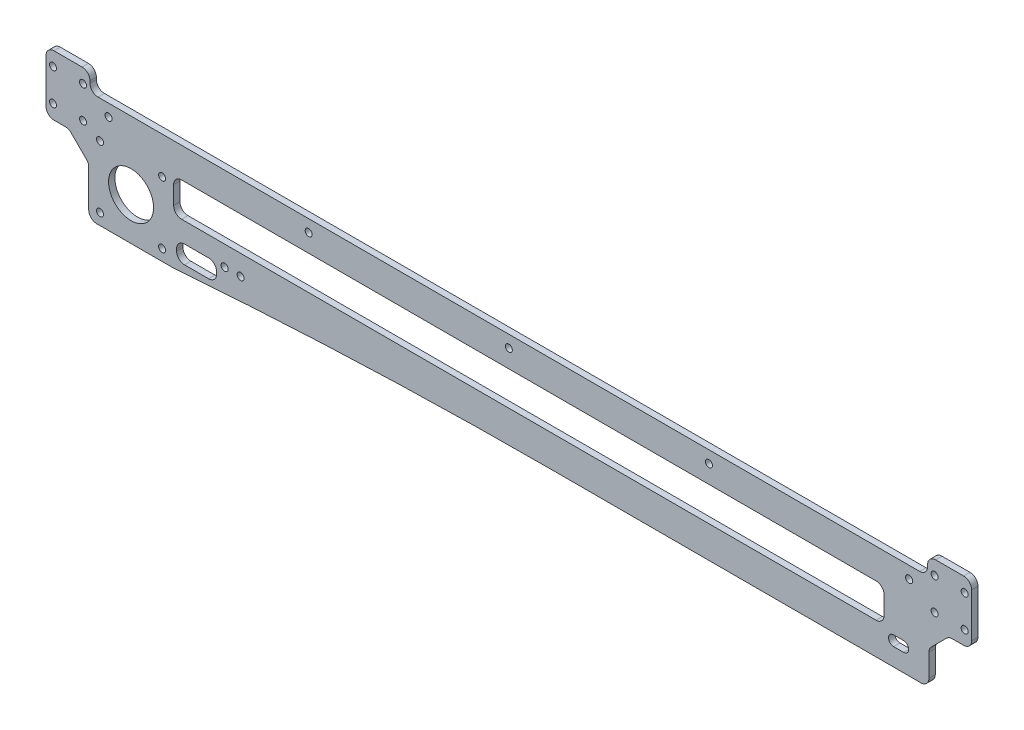
from build123d import *

# Parameters (mm, degrees)
SKETCH5_R          = 1.75
SKETCH5_R_2        = 11.25
SKETCH5_W          = 20
SKETCH5_H          = 9
SKETCH5_W_2        = 355
SKETCH5_H_2        = 17
BASE_FLANGE1_DEPTH = 3.175
FILLET1_R          = 4
CHAMFER1_SIZE      = 10
FILLET2_R          = 4


# Sheet-metal steps are written as plain solids
with BuildPart() as part:
    # Sketch5 → Base-Flange1 (new body)
    with BuildSketch(Plane.XY):
        with BuildLine():
            Line((-209.9, -15), (-209.9, -49.15))
            Line((-209.9, -49.15), (-167.6, -49.15))
            ThreePointArc((-167.6, -49.15), (-73.294416762, -43.720078691), (21.15, -41.909217598))
            Line((21.15, -41.909217598), (209.9, -41.909217598))
            Line((209.9, -41.909217598), (209.9, -15))
            Line((209.9, -15), (231.25, -15))
            Line((231.25, -15), (231.25, 15))
            Line((231.25, 15), (209.25, 15))
            Line((209.25, 15), (209.25, 6))
            Line((209.25, 6), (-209.25, 6))
            Line((-209.25, 6), (-209.25, 15))
            Line((-209.25, 15), (-231.25, 15))
            Line((-231.25, 15), (-231.25, -15))
            Line((-231.25, -15), (-209.9, -15))
        make_face()
        with Locations((-134, -36)):
            Circle(SKETCH5_R, mode=Mode.SUBTRACT)
        with Locations((-142, -36)):
            Circle(SKETCH5_R, mode=Mode.SUBTRACT)
        with Locations((-173.25, -43.5)):
            Circle(SKETCH5_R, mode=Mode.SUBTRACT)
        with Locations((-204.25, -43.5)):
            Circle(SKETCH5_R, mode=Mode.SUBTRACT)
        with Locations((-188.75, -28)):
            Circle(SKETCH5_R_2, mode=Mode.SUBTRACT)
        with Locations((-173.25, -12.5)):
            Circle(SKETCH5_R, mode=Mode.SUBTRACT)
        with Locations((-204.25, -12.5)):
            Circle(SKETCH5_R, mode=Mode.SUBTRACT)
        with Locations((212.75, -8)):
            Circle(SKETCH5_R, mode=Mode.SUBTRACT)
        with Locations((227.75, -8)):
            Circle(SKETCH5_R, mode=Mode.SUBTRACT)
        with Locations((227.75, 8)):
            Circle(SKETCH5_R, mode=Mode.SUBTRACT)
        with Locations((212.75, 8)):
            Circle(SKETCH5_R, mode=Mode.SUBTRACT)
        with Locations((200, 0)):
            Circle(SKETCH5_R, mode=Mode.SUBTRACT)
        with Locations((100, 0)):
            Circle(SKETCH5_R, mode=Mode.SUBTRACT)
        Circle(SKETCH5_R, mode=Mode.SUBTRACT)
        with Locations((-100, 0)):
            Circle(SKETCH5_R, mode=Mode.SUBTRACT)
        with Locations((-200, 0)):
            Circle(SKETCH5_R, mode=Mode.SUBTRACT)
        with Locations((-212.75, -8)):
            Circle(SKETCH5_R, mode=Mode.SUBTRACT)
        with Locations((-212.75, 8)):
            Circle(SKETCH5_R, mode=Mode.SUBTRACT)
        with Locations((-227.75, -8)):
            Circle(SKETCH5_R, mode=Mode.SUBTRACT)
        with Locations((-227.75, 8)):
            Circle(SKETCH5_R, mode=Mode.SUBTRACT)
        with Locations((-156, -40.5)):
            Rectangle(SKETCH5_W, SKETCH5_H, mode=Mode.SUBTRACT)
        with Locations((10, -17.5)):
            Rectangle(SKETCH5_W_2, SKETCH5_H_2, mode=Mode.SUBTRACT)
        with BuildLine():
            Line((197.25, -33.05), (192.25, -33.05))
            ThreePointArc((192.25, -33.05), (189.7, -30.5), (192.25, -27.95))
            Line((192.25, -27.95), (197.25, -27.95))
            ThreePointArc((197.25, -27.95), (199.8, -30.5), (197.25, -33.05))
        make_face(mode=Mode.SUBTRACT)
    extrude(amount=-BASE_FLANGE1_DEPTH)

    # Fillet1
    # the kernel refuses this fillet: 4 mm, written as the material it adds along each edge
    with BuildSketch(Plane(origin=(-209.25, 6, 0), x_dir=(1, 0, 0), z_dir=(0, 0, -1)), Plane(origin=(209.25, 6, 0), x_dir=(0, 1, 0), z_dir=(0, 0, -1)), Plane(origin=(-146, -45, 0), x_dir=(0, 1, 0), z_dir=(0, 0, -1)), Plane(origin=(-166, -36, 0), x_dir=(0, -1, 0), z_dir=(0, 0, -1)), Plane(origin=(-146, -36, 0), x_dir=(-1, 0, 0), z_dir=(0, 0, -1)), Plane(origin=(-167.5, -9, 0), x_dir=(0, -1, 0), z_dir=(0, 0, -1)), Plane(origin=(187.5, -26, 0), x_dir=(0, 1, 0), z_dir=(0, 0, -1)), Plane(origin=(-167.5, -26, 0), x_dir=(1, 0, 0), z_dir=(0, 0, -1))) as fillet1_piece_1:
        with BuildLine():
            CenterArc((FILLET1_R, -FILLET1_R), FILLET1_R, 90, 90)
            Line((0, -FILLET1_R), (0, 0))
            Line((0, 0), (FILLET1_R, 0))
        make_face()
    extrude(amount=3.175)
    with BuildSketch(Plane(origin=(-166, -45, 0), x_dir=(0, 1, 0), z_dir=(0, 0, -1)), Plane(origin=(187.5, -9, 0), x_dir=(0, -1, 0), z_dir=(0, 0, -1))) as fillet1_piece_2:
        with BuildLine():
            CenterArc((FILLET1_R, FILLET1_R), FILLET1_R, 180, 90)
            Line((0, FILLET1_R), (0, 0))
            Line((0, 0), (FILLET1_R, 0))
        make_face()
    extrude(amount=3.175)
    # the kernel refuses this fillet: 4 mm, written as the material it takes off along each edge
    with BuildSketch(Plane(origin=(209.9, -41.909217598, 10), x_dir=(-1, 0, 0), z_dir=(0, 0, -1)), Plane(origin=(-209.9, -49.15, 10), x_dir=(0, 1, 0), z_dir=(0, 0, -1))) as fillet1_2_piece_1:
        with BuildLine():
            CenterArc((FILLET1_R, FILLET1_R), FILLET1_R, 180, 90)
            Line((0, FILLET1_R), (0, 0))
            Line((0, 0), (FILLET1_R, 0))
        make_face()
    extrude(amount=23.175, mode=Mode.SUBTRACT)
    with BuildSketch(Plane(origin=(-167.6, -49.15, 0.383461804), x_dir=(-1, 0, 0), z_dir=(0, 0, -1))) as fillet1_2_piece_2:
        with BuildLine():
            CenterArc((0.153384722, 4), FILLET1_R, 265.609784623, 4.390215377)
            ThreePointArc((-0.152810304, 0.011736643), (-0.076405061, 0.00586951), (0, 0))
            Line((0, 0), (0.153384722, 0))
        make_face()
    extrude(amount=3.941923608, mode=Mode.SUBTRACT)

    # Chamfer1
    chamfer1_edges = [part.edges().sort_by_distance(p)[0] for p in [
        (209.9, -15, -1.5875),
        (-209.9, -15, -1.5875),
    ]]
    chamfer(chamfer1_edges, length=CHAMFER1_SIZE)

    # Fillet2
    fillet2_edges = [part.edges().sort_by_distance(p)[0] for p in [
        (209.25, 15, -1.5875),
        (231.25, 15, -1.5875),
        (231.25, -15, -1.5875),
        (-231.25, -15, -1.5875),
        (-231.25, 15, -1.5875),
        (-209.25, 15, -1.5875),
        (209.9, -25, -1.5875),
        (219.9, -15, -1.5875),
        (-219.9, -15, -1.5875),
        (-209.9, -25, -1.5875),
    ]]
    fillet(fillet2_edges, radius=FILLET2_R)


solid = part.part
